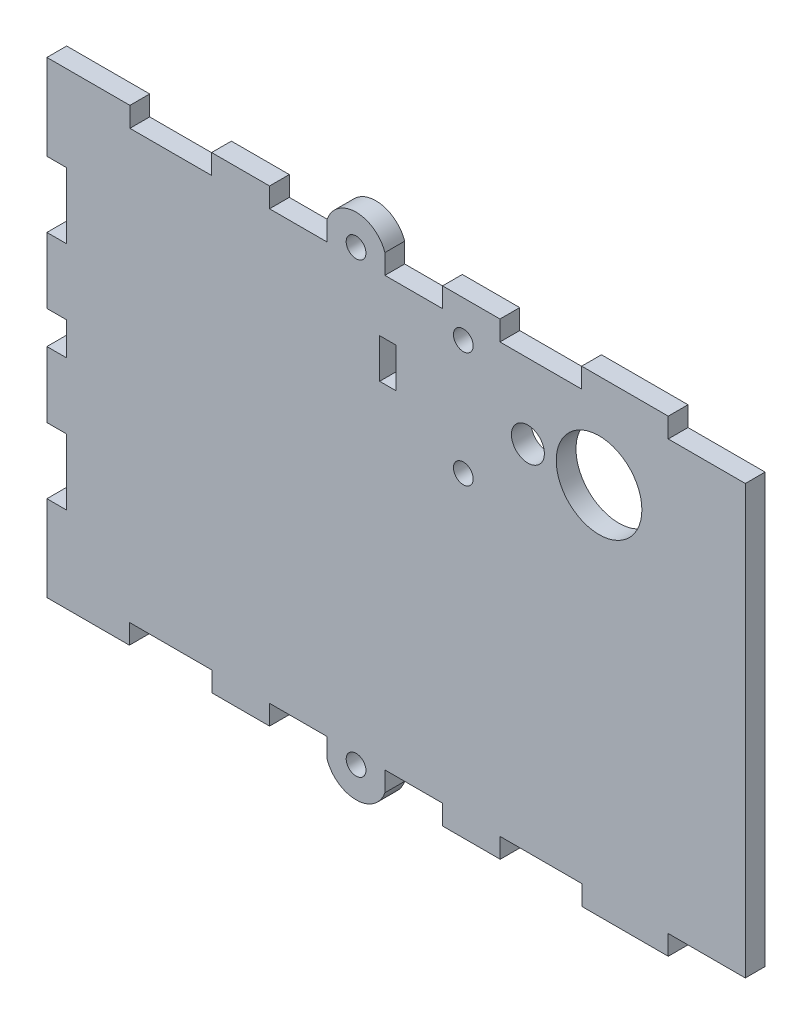
from build123d import *
from OCP.BRepAlgoAPI import BRepAlgoAPI_Cut
from OCP.TopTools import TopTools_ListOfShape

# Parameters (mm, degrees)
CROQUIS1_R              = 1.500000001
SALIENTE_EXTRUIR1_DEPTH = 3
CROQUIS4_W              = 3
CROQUIS4_H              = 71.0001277
SALIENTE_EXTRUIR2_DEPTH = 15
CROQUIS5_R              = 6.5
CROQUIS5_R_2            = 1.5
CROQUIS5_R_3            = 2.5
CROQUIS5_W              = 2.499996062
CROQUIS5_H              = 6.000001641
CORTAR_EXTRUIR1_DEPTH   = 10
CORTAR_EXTRUIR3_START   = -4
CORTAR_EXTRUIR3_DEPTH   = 5
CROQUIS7_W              = 3
CROQUIS7_H              = 65.000131742
CORTAR_EXTRUIR4_DEPTH   = 9


with BuildPart() as part:
    # Croquis1 → Saliente-Extruir1 (new body)
    with BuildSketch(Plane.XY):
        with BuildLine():
            Line((314.494178041, 188.579504075), (317.494178043, 188.579506619))
            Line((317.494178043, 188.579506619), (317.494186524, 178.579506615))
            Line((317.494186524, 178.579506615), (314.494177731, 178.579504071))
            Line((314.494177731, 178.579504071), (314.494186212, 168.579504067))
            Line((314.494186212, 168.579504067), (317.494186214, 168.579506611))
            Line((317.494186214, 168.579506611), (317.494190454, 163.579648323))
            Line((317.494190454, 163.579648323), (314.494168474, 163.579645778))
            Line((314.494168474, 163.579645778), (314.494176956, 153.579645774))
            Line((314.494176956, 153.579645774), (317.494159374, 153.579648318))
            Line((317.494159374, 153.579648318), (317.494167855, 143.579648314))
            Line((317.494167855, 143.579648314), (314.494167854, 143.57964577))
            Line((314.494167854, 143.57964577), (314.494173605, 130.579645765))
            Line((314.494173605, 130.579645765), (327.013519861, 130.579618443))
            Line((327.013519861, 130.579618443), (327.013522591, 133.579618444))
            Line((327.013522591, 133.579618444), (339.532765197, 133.579591123))
            Line((339.532765197, 133.579591123), (339.532765197, 130.57943755))
            Line((339.532765197, 130.57943755), (348.284914925, 130.579428178))
            Line((348.284914925, 130.579428178), (348.284918137, 133.579395242))
            Line((348.284918137, 133.579395242), (357.034918141, 133.579385871))
            Line((357.034918141, 133.579385871), (357.034914928, 130.57938587))
            ThreePointArc((357.034914928, 130.57938587), (361.414562849, 127.449962294), (365.794217472, 130.57937649))
            Line((365.794217472, 130.57937649), (365.794220685, 133.579299126))
            Line((365.794220685, 133.579299126), (374.544220688, 133.579289756))
            Line((374.544220688, 133.579289756), (374.544217476, 130.579290106))
            Line((374.544217476, 130.579290106), (383.294100119, 130.579288157))
            Line((383.294100119, 130.579288157), (383.294100787, 133.579288158))
            Line((383.294100787, 133.579288158), (395.694123645, 133.579285396))
            Line((395.694123645, 133.579285396), (395.694122977, 130.579285394))
            Line((395.694122977, 130.579285394), (414.49422245, 130.579281206))
            Line((414.49422245, 130.579281206), (414.494175849, 201.579408906))
            Line((414.494175849, 201.579408906), (395.654796079, 201.579436111))
            Line((395.654796079, 201.579436111), (395.654796079, 198.559911251))
            Line((395.654796079, 198.559911251), (383.254781657, 198.559889448))
            Line((383.254781657, 198.559889448), (383.254781657, 201.579454018))
            Line((383.254781657, 201.579454018), (374.544176149, 201.579466597))
            Line((374.544176149, 201.579466597), (374.544170874, 198.579568646))
            Line((374.544170874, 198.579568646), (365.794170871, 198.579584031))
            Line((365.794170871, 198.579584031), (365.794176145, 201.579506668))
            ThreePointArc((365.794176145, 201.579506668), (361.414530376, 204.708933254), (357.034873601, 201.579522069))
            Line((357.034873601, 201.579522069), (357.034868326, 198.579522068))
            Line((357.034868326, 198.579522068), (348.284868323, 198.579537453))
            Line((348.284868323, 198.579537453), (348.284873598, 201.579504517))
            Line((348.284873598, 201.579504517), (339.493492813, 201.579517212))
            Line((339.493492813, 201.579517212), (339.493492813, 198.559812504))
            Line((339.493492813, 198.559812504), (327.093469951, 198.559790701))
            Line((327.093469951, 198.559790701), (327.093469951, 201.579535118))
            Line((327.093469951, 201.579535118), (314.494181082, 201.579553313))
            Line((314.494181082, 201.579553313), (314.494178041, 188.579504075))
        make_face()
        with Locations((361.414522236, 200.079542161)):
            Circle(CROQUIS1_R, mode=Mode.SUBTRACT)
        with Locations((361.414567806, 132.079353387)):
            Circle(CROQUIS1_R, mode=Mode.SUBTRACT)
    extrude(amount=SALIENTE_EXTRUIR1_DEPTH)

    # Croquis4 → Saliente-Extruir2 (add)
    with BuildSketch(Plane(origin=(414.494308155, 0.000272052, 0), x_dir=(0, 0, -1), z_dir=(0.9999999999997846, 6.563478556519826e-07, 0))):
        with Locations((-1.5, 166.079073004)):
            Rectangle(CROQUIS4_W, CROQUIS4_H)
    extrude(amount=SALIENTE_EXTRUIR2_DEPTH)

    # Croquis5 → Cortar-Extruir1 (cut)
    with BuildSketch(Plane.XY.offset(3)):
        with Locations((398.294185249, 187.258674364)):
            Circle(CROQUIS5_R)
        with Locations((377.694190992, 178.508660843)):
            Circle(CROQUIS5_R_2)
        with Locations((377.694179506, 196.008660843)):
            Circle(CROQUIS5_R_2)
        with Locations((387.494185249, 187.258667276)):
            Circle(CROQUIS5_R_3)
        with Locations((366.244185249, 187.258653329)):
            Rectangle(CROQUIS5_W, CROQUIS5_H)
    extrude(amount=-CORTAR_EXTRUIR1_DEPTH, mode=Mode.SUBTRACT)

    # Cortar-Extruir3: read off the stored shape, not the designer's step
    # Cortar-Extruir3 outline → Cortar-Extruir3 (cut)
    with BuildSketch(Plane(origin=(0, 0, 0), x_dir=(-1, 0, 0), z_dir=(0, 0, -1)).offset(CORTAR_EXTRUIR3_START)):
        Polygon((-429.494175849, 201.579418751), (-429.494177818, 198.579417138), (-408.794180476, 198.579417138), (-408.794180476, 201.579418751), (-414.494175849, 201.579408906), align=None)
        Polygon((-408.79422983, 133.579285396), (-429.49422245, 133.579285396), (-429.49422245, 130.579291051), (-414.49422245, 130.579281206), (-408.79422983, 130.579282476), align=None)
    extrude(amount=CORTAR_EXTRUIR3_DEPTH, mode=Mode.SUBTRACT)


with BuildPart() as cortar_extruir4_tool:
    # Croquis7 → Cortar-Extruir4 (new body)
    with BuildSketch(Plane(origin=(429.494308155, 0.000281898, 0), x_dir=(0, 0, -1), z_dir=(0.9999999999997846, 6.563478556519826e-07, 0))):
        with Locations((-1.5, 166.079069369)):
            Rectangle(CROQUIS7_W, CROQUIS7_H)
    extrude(amount=-CORTAR_EXTRUIR4_DEPTH)


with BuildPart() as part_1:
    add(part.part)

    # Cortar-Extruir4: cut by cortar_extruir4_tool, with a tolerance
    cortar_extruir4_stock = TopTools_ListOfShape()
    cortar_extruir4_stock.Append(part_1.part.wrapped)
    cortar_extruir4_tools = TopTools_ListOfShape()
    cortar_extruir4_tools.Append(cortar_extruir4_tool.part.wrapped)
    cortar_extruir4_cut = BRepAlgoAPI_Cut()
    cortar_extruir4_cut.SetArguments(cortar_extruir4_stock)
    cortar_extruir4_cut.SetTools(cortar_extruir4_tools)
    cortar_extruir4_cut.SetFuzzyValue(0.00001)
    cortar_extruir4_cut.Build()
    add(Compound.cast(cortar_extruir4_cut.Shape()).solids(), mode=Mode.REPLACE)


solid = part_1.part
